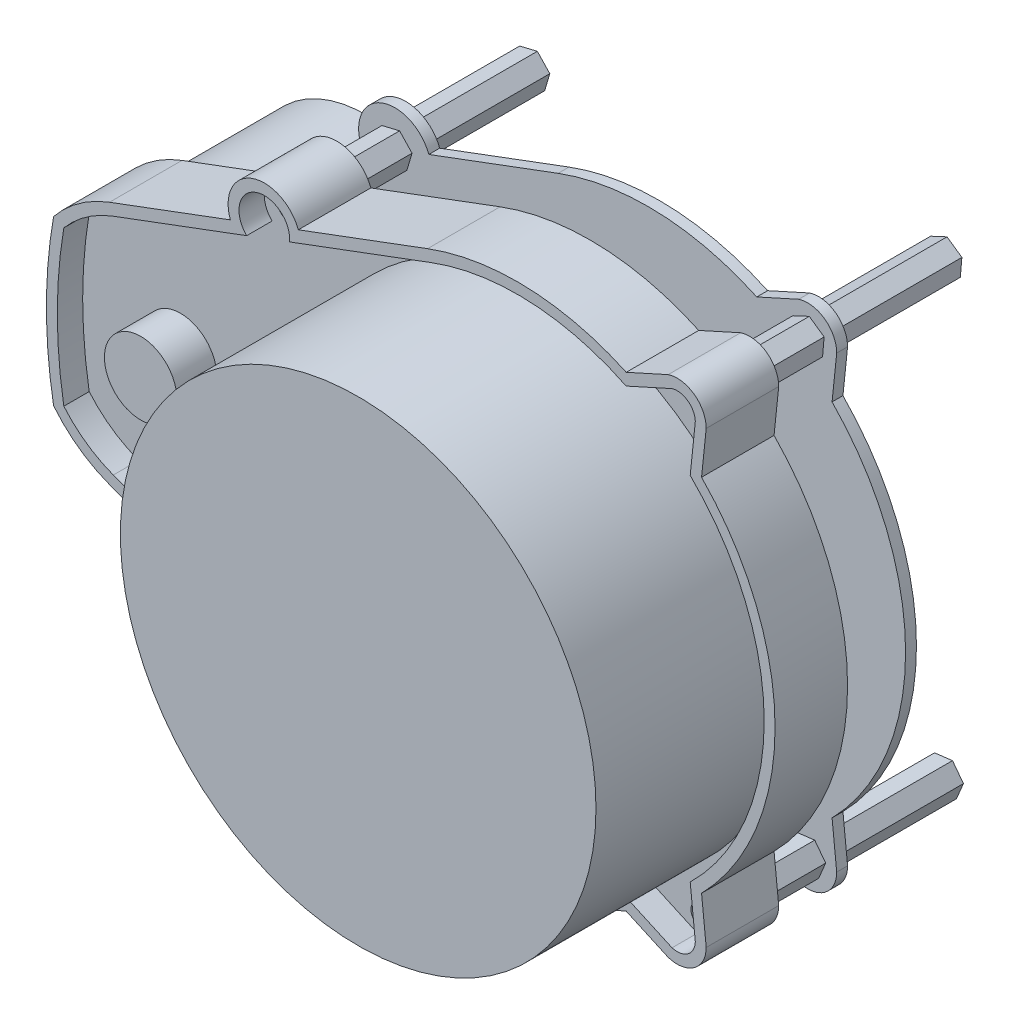
from build123d import *

# Parameters (mm, degrees)
ESQUISSE1_R             = 1.6
BOSS_EXTRU_1_DEPTH      = 10
ESQUISSE2_R             = 32.8
BOSS_EXTRU_2_DEPTH      = 22
ENL_V_MAT_EXTRU_1_DEPTH = 3.5
BOSS_EXTRU_3_REACH      = 79.261
ESQUISSE4_R             = 32.8
ESQUISSE5_R             = 16
BOSS_EXTRU_4_DEPTH      = 19
ESQUISSE6_R             = 1
BOSS_EXTRU_5_DEPTH      = 27
BOSS_EXTRU_6_DEPTH      = 1.5
ESQUISSE8_R             = 5
BOSS_EXTRU_7_DEPTH      = 5.5


with BuildPart() as part:
    # Esquisse1 → Boss.-Extru.1 (new body)
    with BuildSketch(Plane.XY):
        with BuildLine():
            ThreePointArc((14.973963383, 32.187426436), (1.381675102, 35.473102119), (-12.425, 33.254614341))
            Line((-12.425, 33.254614341), (-30.257191628, 26.591930519))
            ThreePointArc((-30.257191628, 26.591930519), (-36.690940127, 29.525679018), (-39.624688626, 23.091930519))
            Line((-39.624688626, 23.091930519), (-56.3, 16.861494596))
            ThreePointArc((-56.3, 16.861494596), (-60.528670487, 14.599558136), (-64.01, 11.301322931))
            ThreePointArc((-64.01, 11.301322931), (-65, 0), (-64.01, -11.301322931))
            ThreePointArc((-64.01, -11.301322931), (-60.528670487, -14.599558136), (-56.3, -16.861494596))
            Line((-56.3, -16.861494596), (-39.624688626, -23.091930519))
            ThreePointArc((-39.624688626, -23.091930519), (-36.690940127, -29.525679018), (-30.257191628, -26.591930519))
            Line((-30.257191628, -26.591930519), (-12.425, -33.254614341))
            ThreePointArc((-12.425, -33.254614341), (1.381675102, -35.473102119), (14.973963383, -32.187426436))
            Line((14.973963383, -32.187426436), (20.756023105, -34.801647207))
            ThreePointArc((20.756023105, -34.801647207), (24.347774736, -34.238511045), (26, -31))
            Line((26, -31), (25.359978077, -24.841930519))
            ThreePointArc((25.359978077, -24.841930519), (35.5, 0), (25.359978077, 24.841930519))
            Line((25.359978077, 24.841930519), (26, 31))
            ThreePointArc((26, 31), (24.347774736, 34.238511045), (20.756023105, 34.801647207))
            Line((20.756023105, 34.801647207), (14.973963383, 32.187426436))
        make_face()
        with BuildLine():
            ThreePointArc((-33.4, -25), (-33.412675015, -25.200995999), (-33.45049924, -25.398807464))
            ThreePointArc((-33.45049924, -25.398807464), (-35.56, -26.49879952), (-36.431381015, -24.285053575))
            ThreePointArc((-36.431381015, -24.285053575), (-34.632719197, -23.442725197), (-33.4, -25))
        make_face(mode=Mode.SUBTRACT)
        with Locations((22, -31)):
            Circle(ESQUISSE1_R, mode=Mode.SUBTRACT)
        with BuildLine():
            ThreePointArc((-36.431381015, 24.285053575), (-35.56, 26.49879952), (-33.45049924, 25.398807464))
            ThreePointArc((-33.45049924, 25.398807464), (-33.412675015, 25.200995999), (-33.4, 25))
            ThreePointArc((-33.4, 25), (-34.632719197, 23.442725197), (-36.431381015, 24.285053575))
        make_face(mode=Mode.SUBTRACT)
        with Locations((22, 31)):
            Circle(ESQUISSE1_R, mode=Mode.SUBTRACT)
    extrude(amount=BOSS_EXTRU_1_DEPTH)

    # Esquisse2 → Boss.-Extru.2 (add)
    with BuildSketch(Plane.XY.offset(10)):
        Circle(ESQUISSE2_R)
    extrude(amount=BOSS_EXTRU_2_DEPTH)

    # Esquisse3 → Enlèv. mat.-Extru.1 (cut)
    with BuildSketch(Plane.XY.offset(10)):
        with BuildLine():
            Line((-55.775, -15.456370046), (-37.378202776, -22.330008789))
            ThreePointArc((-37.378202776, -22.330008789), (-36.165940127, -28.120554469), (-31.453677478, -24.543603151))
            Line((-31.453677478, -24.543603151), (-11.9, -31.849489792))
            ThreePointArc((-11.9, -31.849489792), (1.664031028, -33.959255009), (14.956816294, -30.533484019))
            Line((14.956816294, -30.533484019), (21.291141631, -33.397398551))
            ThreePointArc((21.291141631, -33.397398551), (23.468656713, -33.023128137), (24.499056843, -31.06866508))
            Line((24.499056843, -31.06866508), (23.79417774, -24.286562245))
            ThreePointArc((23.79417774, -24.286562245), (34, 0), (23.79417774, 24.286562245))
            Line((23.79417774, 24.286562245), (24.499056843, 31.06866508))
            ThreePointArc((24.499056843, 31.06866508), (23.468656713, 33.023128137), (21.291141631, 33.397398551))
            Line((21.291141631, 33.397398551), (14.956816294, 30.533484019))
            ThreePointArc((14.956816294, 30.533484019), (1.664031028, 33.959255009), (-11.9, 31.849489792))
            Line((-11.9, 31.849489792), (-31.453677478, 24.543603151))
            ThreePointArc((-31.453677478, 24.543603151), (-36.165940127, 28.120554469), (-37.378202776, 22.330008789))
            Line((-37.378202776, 22.330008789), (-55.775, 15.456370046))
            ThreePointArc((-55.775, 15.456370046), (-59.496201473, 13.493411636), (-62.6, 10.653168543))
            ThreePointArc((-62.6, 10.653168543), (-63.5, 0), (-62.6, -10.653168543))
            ThreePointArc((-62.6, -10.653168543), (-59.496201473, -13.493411636), (-55.775, -15.456370046))
        make_face()
    extrude(amount=-ENL_V_MAT_EXTRU_1_DEPTH, mode=Mode.SUBTRACT)


with BuildPart() as enl_v_mat_extru_1_piece_1:
    # of the separate pieces the step leaves, piece 1, a body of its own (enl_v_mat_extru_1_pieces)
    add(part.part.solids().sort_by_distance((32.8, 0, 10))[0])


with BuildPart() as enl_v_mat_extru_1_piece_2:
    # of the separate pieces the step leaves, piece 2, a body of its own (enl_v_mat_extru_1_pieces)
    add(part.part.solids().sort_by_distance((14.973963383, 32.187426436, 0))[0])

    # Esquisse4 → Boss.-Extru.3 (add, up to next)
    with BuildSketch(Plane(origin=(0, 0, 10), x_dir=(-1, 0, 0), z_dir=(0, 0, -1)), mode=Mode.PRIVATE) as boss_extru_3_sk1:
        Circle(ESQUISSE4_R)
    boss_extru_3_tool1 = extrude(boss_extru_3_sk1.sketch, amount=BOSS_EXTRU_3_REACH, mode=Mode.PRIVATE) - enl_v_mat_extru_1_piece_2.part

    add(enl_v_mat_extru_1_piece_1.part)  # Boss.-Extru.3 merges Enlèv. mat.-Extru.1 piece 1
    add(boss_extru_3_tool1.solids().sort_by_distance((0, 0, 10))[0])

    # Esquisse5 → Boss.-Extru.4 (add)
    with BuildSketch(Plane(origin=(0, 0, 0), x_dir=(-1, 0, 0), z_dir=(0, 0, -1))):
        with Locations((50, 0)):
            Circle(ESQUISSE5_R)
    extrude(amount=BOSS_EXTRU_4_DEPTH)

    # Esquisse6 → Boss.-Extru.5 (add)
    # profile 1 of 4: a face of its own
    with BuildSketch(Plane(origin=(0, 0, 0), x_dir=(-1, 0, 0), z_dir=(0, 0, -1))):
        Polygon((-20.489225606, -29.008126327), (-22.969626005, -28.695694159), (-24.480400399, -30.687567832), (-23.510774394, -32.991873673), (-21.030373995, -33.304305841), (-19.519599601, -31.312432168), align=None)
        with Locations((-22, -31)):
            Circle(ESQUISSE6_R, mode=Mode.SUBTRACT)
    # profile 2 of 4: a face of its own
    with BuildSketch(Plane(origin=(0, 0, 0), x_dir=(-1, 0, 0), z_dir=(0, 0, -1))):
        Polygon((36.086835018, -22.748602735), (33.593650283, -22.933074633), (32.506815266, -25.184471898), (33.913164982, -27.251397265), (36.406349717, -27.066925367), (37.493184734, -24.815528102), align=None)
        with Locations((35, -25)):
            Circle(ESQUISSE6_R, mode=Mode.SUBTRACT)
    # profile 3 of 4: a face of its own
    with BuildSketch(Plane(origin=(0, 0, 0), x_dir=(-1, 0, 0), z_dir=(0, 0, -1))):
        Polygon((36.720274889, 26.814016072), (34.289153443, 27.396809791), (32.568878555, 25.582793719), (33.279725111, 23.185983928), (35.710846557, 22.603190209), (37.431121445, 24.417206281), align=None)
        with Locations((35, 25)):
            Circle(ESQUISSE6_R, mode=Mode.SUBTRACT)
    # profile 4 of 4: a face of its own
    with BuildSketch(Plane(origin=(0, 0, 0), x_dir=(-1, 0, 0), z_dir=(0, 0, -1))):
        Polygon((-19.952160425, 32.43399898), (-22.217959758, 33.490480585), (-24.265799333, 32.056481605), (-24.047839575, 29.56600102), (-21.782040242, 28.509519415), (-19.734200667, 29.943518395), align=None)
        with Locations((-22, 31)):
            Circle(ESQUISSE6_R, mode=Mode.SUBTRACT)
    extrude(amount=BOSS_EXTRU_5_DEPTH)

    # Esquisse7 → Boss.-Extru.6 (add)
    with BuildSketch(Plane(origin=(0, 0, -8), x_dir=(-1, 0, 0), z_dir=(0, 0, -1))):
        with BuildLine():
            Line((30.257191628, 26.591930519), (12.425, 33.254614341))
            ThreePointArc((12.425, 33.254614341), (-1.381675102, 35.473102119), (-14.973963383, 32.187426436))
            Line((-14.973963383, 32.187426436), (-20.756023105, 34.801647207))
            ThreePointArc((-20.756023105, 34.801647207), (-24.347774736, 34.238511045), (-26, 31))
            Line((-26, 31), (-25.359978077, 24.841930519))
            ThreePointArc((-25.359978077, 24.841930519), (-35.5, 0), (-25.359978077, -24.841930519))
            Line((-25.359978077, -24.841930519), (-26, -31))
            ThreePointArc((-26, -31), (-24.347774736, -34.238511045), (-20.756023105, -34.801647207))
            Line((-20.756023105, -34.801647207), (-14.973963383, -32.187426436))
            ThreePointArc((-14.973963383, -32.187426436), (-1.381675102, -35.473102119), (12.425, -33.254614341))
            Line((12.425, -33.254614341), (30.257191628, -26.591930519))
            ThreePointArc((30.257191628, -26.591930519), (36.690940127, -29.525679018), (39.624688626, -23.091930519))
            ThreePointArc((39.624688626, -23.091930519), (33.487603548, 0), (39.624688626, 23.091930519))
            ThreePointArc((39.624688626, 23.091930519), (36.690940127, 29.525679018), (30.257191628, 26.591930519))
        make_face()
    extrude(amount=BOSS_EXTRU_6_DEPTH)

    # Esquisse8 → Boss.-Extru.7 (add)
    with BuildSketch(Plane.XY.offset(6.5)):
        with Locations((-50, 0)):
            Circle(ESQUISSE8_R)
    extrude(amount=BOSS_EXTRU_7_DEPTH)


solid = enl_v_mat_extru_1_piece_2.part
